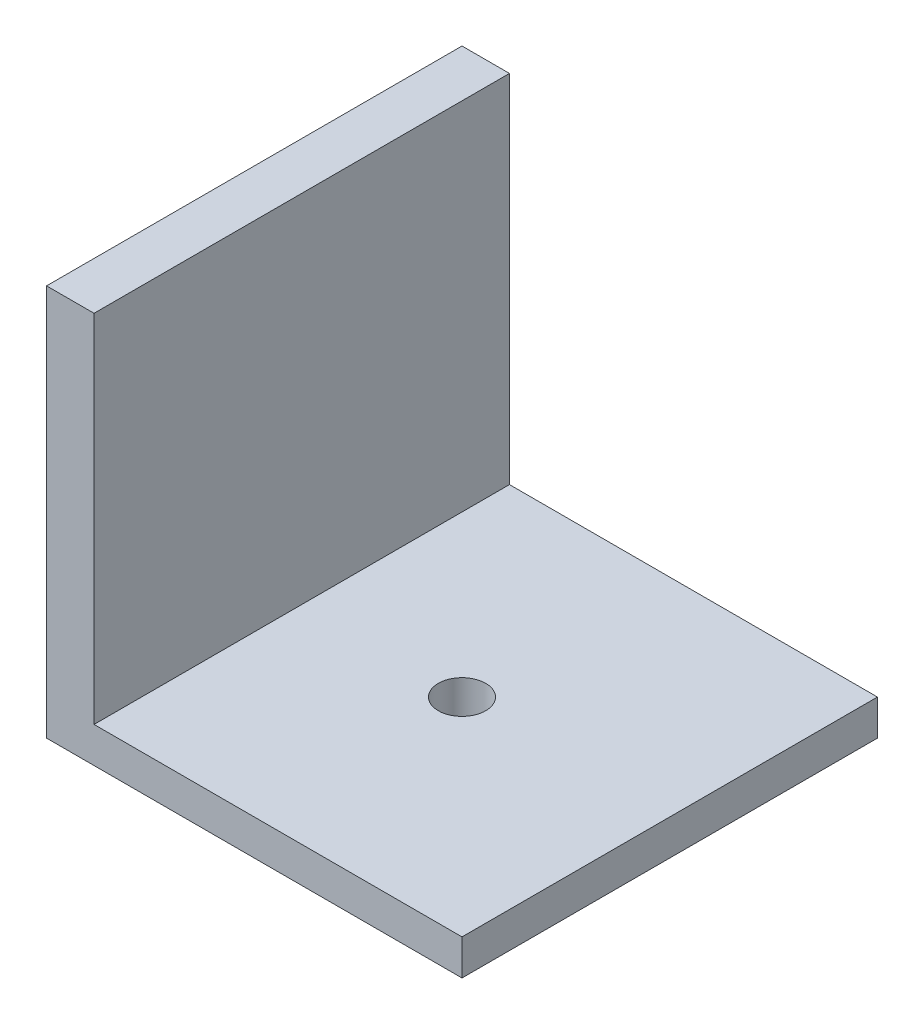
from build123d import *

# Parameters (mm, degrees)
SKETCH1_W           = 35
SKETCH1_H           = 35
SKETCH1_R           = 2
BOSS_EXTRUDE1_DEPTH = 3
SKETCH2_W           = 4
SKETCH2_H           = 35
BOSS_EXTRUDE2_DEPTH = 30
SKETCH3_R           = 4
BOSS_EXTRUDE3_DEPTH = 8


with BuildPart() as part:
    # Sketch1 → Boss-Extrude1 (new body)
    with BuildSketch(Plane(origin=(0, 0, 0), x_dir=(1, 0, 0), z_dir=(0, 1, 0))):
        Rectangle(SKETCH1_W, SKETCH1_H)
        Circle(SKETCH1_R, mode=Mode.SUBTRACT)
    extrude(amount=BOSS_EXTRUDE1_DEPTH)

    # Sketch2 → Boss-Extrude2 (add)
    with BuildSketch(Plane(origin=(0, 3, 0), x_dir=(1, 0, 0), z_dir=(0, 1, 0))):
        with Locations((-15.5, 0)):
            Rectangle(SKETCH2_W, SKETCH2_H)
    extrude(amount=BOSS_EXTRUDE2_DEPTH)

    # Sketch3 → Boss-Extrude3 (add)
    with BuildSketch(Plane.ZY.offset(17.5)):
        with Locations((0, 16.5)):
            Circle(SKETCH3_R)
    extrude(amount=BOSS_EXTRUDE3_DEPTH)


solid = part.part
